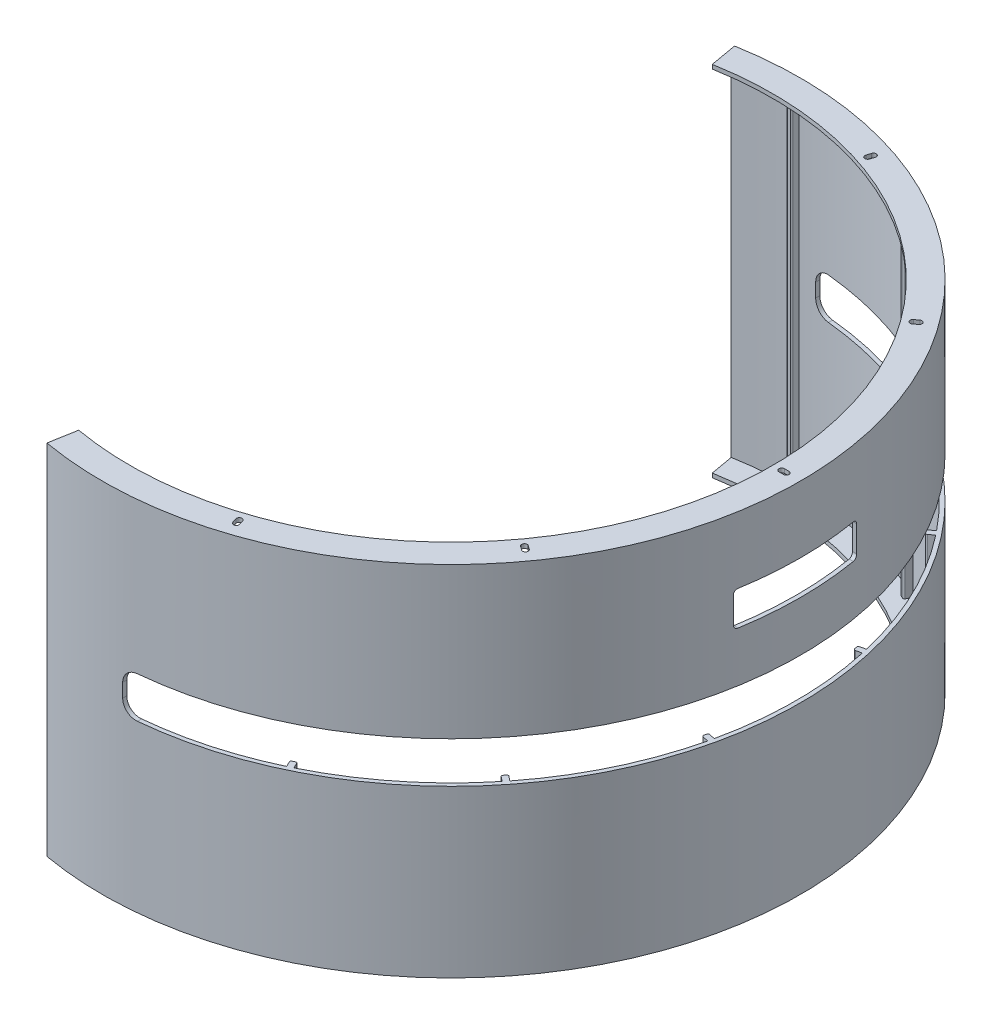
from build123d import *

# Parameters (mm, degrees)
BOSS_EXTRUDE1_DEPTH   = 255
BOSS_EXTRUDE2_DEPTH   = 255
BOSS_EXTRUDE2_2_DEPTH = 255
BOSS_EXTRUDE2_3_DEPTH = 255
BOSS_EXTRUDE2_4_DEPTH = 255
BOSS_EXTRUDE2_5_DEPTH = 255
BOSS_EXTRUDE2_6_DEPTH = 255
BOSS_EXTRUDE2_7_DEPTH = 255
BOSS_EXTRUDE2_8_DEPTH = 255
SKETCH4_W             = 480
SKETCH4_H             = 30
CUT_EXTRUDE2_DEPTH    = 476.5
FILLET2_R             = 10
BOSS_EXTRUDE3_DEPTH   = 3
CUT_EXTRUDE3_DEPTH    = 5
LPATTERN1_COUNT       = 2
LPATTERN1_PITCH       = 258
LPATTERN2_COUNT       = 2
LPATTERN2_PITCH       = 258
SKETCH9_W             = 27.100731328
SKETCH9_H             = 25
CUT_EXTRUDE4_DEPTH    = 45
FILLET3_R             = 3


with BuildPart() as part:
    # Sketch3 → Boss-Extrude1 (new body)
    with BuildSketch(Plane(origin=(0, 0, 0), x_dir=(1, 0, 0), z_dir=(0, 1, 0))):
        with BuildLine():
            ThreePointArc((0, 251.5), (251.5, 0), (0, -251.5))
            ThreePointArc((0, -251.5), (-21.919669301, -250.54296657), (-43.672516683, -247.679149883))
            Line((-43.672516683, -247.679149883), (-44.193461216, -250.633573142))
            ThreePointArc((-44.193461216, -250.633573142), (-22.181136529, -253.531550664), (0, -254.5))
            ThreePointArc((0, -254.5), (254.5, 0), (0, 254.5))
            ThreePointArc((0, 254.5), (-22.181136529, 253.531550664), (-44.193461216, 250.633573142))
            Line((-44.193461216, 250.633573142), (-43.672516683, 247.679149883))
            ThreePointArc((-43.672516683, 247.679149883), (-21.919669301, 250.54296657), (0, 251.5))
        make_face()
    extrude(amount=BOSS_EXTRUDE1_DEPTH)


with BuildPart() as body_2:
    # Sketch6 → Boss-Extrude2 (new body)
    with BuildSketch(Plane(origin=(0, 255, 0), x_dir=(1, 0, 0), z_dir=(0, 1, 0))):
        with BuildLine():
            Line((-2, 253.081926056), (-2, 247.081926056))
            ThreePointArc((-2, 247.081926056), (-1.707106781, 246.374819275), (-1, 246.081926056))
            Line((-1, 246.081926056), (1, 246.081926056))
            ThreePointArc((1, 246.081926056), (1.707106781, 246.374819275), (2, 247.081926056))
            Line((2, 247.081926056), (2, 253.081926056))
            Line((2, 253.081926056), (-2, 253.081926056))
        make_face()
    extrude(amount=-BOSS_EXTRUDE2_DEPTH)


with BuildPart() as body_3:
    # Sketch6 → Boss-Extrude2 2 (new body)
    with BuildSketch(Plane(origin=(0, 255, 0), x_dir=(1, 0, 0), z_dir=(0, 1, 0))):
        with BuildLine():
            Line((108.006194645, 228.886703884), (105.40289221, 223.480890676))
            ThreePointArc((105.40289221, 223.480890676), (105.359977747, 222.716727875), (105.869977339, 222.146038069))
            Line((105.869977339, 222.146038069), (107.671915074, 221.278270591))
            ThreePointArc((107.671915074, 221.278270591), (108.436077876, 221.235356129), (109.006767681, 221.74535572))
            Line((109.006767681, 221.74535572), (111.610070116, 227.151168927))
            Line((111.610070116, 227.151168927), (108.006194645, 228.886703884))
        make_face()
    extrude(amount=-BOSS_EXTRUDE2_2_DEPTH)


with BuildPart() as body_4:
    # Sketch6 → Boss-Extrude2 3 (new body)
    with BuildSketch(Plane(origin=(0, 255, 0), x_dir=(1, 0, 0), z_dir=(0, 1, 0))):
        with BuildLine():
            Line((196.620437831, 159.357662896), (191.929448936, 155.616724085))
            ThreePointArc((191.929448936, 155.616724085), (191.559226528, 154.946857078), (191.771107255, 154.2114028))
            Line((191.771107255, 154.2114028), (193.018086859, 152.647739835))
            ThreePointArc((193.018086859, 152.647739835), (193.687953865, 152.277517427), (194.423408143, 152.489398155))
            Line((194.423408143, 152.489398155), (199.114397038, 156.230336966))
            Line((199.114397038, 156.230336966), (196.620437831, 159.357662896))
        make_face()
    extrude(amount=-BOSS_EXTRUDE2_3_DEPTH)


with BuildPart() as body_5:
    # Sketch6 → Boss-Extrude2 4 (new body)
    with BuildSketch(Plane(origin=(0, 255, 0), x_dir=(1, 0, 0), z_dir=(0, 1, 0))):
        with BuildLine():
            Line((246.291591913, 58.265882378), (240.44202444, 56.930756774))
            ThreePointArc((240.44202444, 56.930756774), (239.817821175, 56.487860938), (239.689617462, 55.733307928))
            Line((239.689617462, 55.733307928), (240.13465933, 53.783452104))
            ThreePointArc((240.13465933, 53.783452104), (240.577555165, 53.159248838), (241.332108176, 53.031045125))
            Line((241.332108176, 53.031045125), (247.181675649, 54.366170729))
            Line((247.181675649, 54.366170729), (246.291591913, 58.265882378))
        make_face()
    extrude(amount=-BOSS_EXTRUDE2_4_DEPTH)


with BuildPart() as body_6:
    # Sketch6 → Boss-Extrude2 5 (new body)
    with BuildSketch(Plane(origin=(0, 255, 0), x_dir=(1, 0, 0), z_dir=(0, 1, 0))):
        with BuildLine():
            Line((247.181675649, -54.366170729), (241.332108176, -53.031045125))
            ThreePointArc((241.332108176, -53.031045125), (240.577555165, -53.159248838), (240.13465933, -53.783452104))
            Line((240.13465933, -53.783452104), (239.689617462, -55.733307928))
            ThreePointArc((239.689617462, -55.733307928), (239.817821175, -56.487860938), (240.44202444, -56.930756774))
            Line((240.44202444, -56.930756774), (246.291591913, -58.265882378))
            Line((246.291591913, -58.265882378), (247.181675649, -54.366170729))
        make_face()
    extrude(amount=-BOSS_EXTRUDE2_5_DEPTH)


with BuildPart() as body_7:
    # Sketch6 → Boss-Extrude2 6 (new body)
    with BuildSketch(Plane(origin=(0, 255, 0), x_dir=(1, 0, 0), z_dir=(0, 1, 0))):
        with BuildLine():
            Line((199.114397038, -156.230336966), (194.423408143, -152.489398155))
            ThreePointArc((194.423408143, -152.489398155), (193.687953865, -152.277517427), (193.018086859, -152.647739835))
            Line((193.018086859, -152.647739835), (191.771107255, -154.2114028))
            ThreePointArc((191.771107255, -154.2114028), (191.559226528, -154.946857078), (191.929448936, -155.616724085))
            Line((191.929448936, -155.616724085), (196.620437831, -159.357662896))
            Line((196.620437831, -159.357662896), (199.114397038, -156.230336966))
        make_face()
    extrude(amount=-BOSS_EXTRUDE2_6_DEPTH)


with BuildPart() as body_8:
    # Sketch6 → Boss-Extrude2 7 (new body)
    with BuildSketch(Plane(origin=(0, 255, 0), x_dir=(1, 0, 0), z_dir=(0, 1, 0))):
        with BuildLine():
            Line((111.610070116, -227.151168927), (109.006767681, -221.74535572))
            ThreePointArc((109.006767681, -221.74535572), (108.436077876, -221.235356129), (107.671915074, -221.278270591))
            Line((107.671915074, -221.278270591), (105.869977339, -222.146038069))
            ThreePointArc((105.869977339, -222.146038069), (105.359977747, -222.716727875), (105.40289221, -223.480890676))
            Line((105.40289221, -223.480890676), (108.006194645, -228.886703884))
            Line((108.006194645, -228.886703884), (111.610070116, -227.151168927))
        make_face()
    extrude(amount=-BOSS_EXTRUDE2_7_DEPTH)


with BuildPart() as body_9:
    # Sketch6 → Boss-Extrude2 8 (new body)
    with BuildSketch(Plane(origin=(0, 255, 0), x_dir=(1, 0, 0), z_dir=(0, 1, 0))):
        with BuildLine():
            Line((2, -253.081926056), (2, -247.081926056))
            ThreePointArc((2, -247.081926056), (1.707106781, -246.374819275), (1, -246.081926056))
            Line((1, -246.081926056), (-1, -246.081926056))
            ThreePointArc((-1, -246.081926056), (-1.707106781, -246.374819275), (-2, -247.081926056))
            Line((-2, -247.081926056), (-2, -253.081926056))
            Line((-2, -253.081926056), (2, -253.081926056))
        make_face()
    extrude(amount=-BOSS_EXTRUDE2_8_DEPTH)


with BuildPart() as body_2_1:
    add(body_2.part)

    # Combine2: union part, body 3, body 4, body 5, body 6, body 7, body 8, body 9
    add(part.part)
    add(body_3.part)
    add(body_4.part)
    add(body_5.part)
    add(body_6.part)
    add(body_7.part)
    add(body_8.part)
    add(body_9.part)

    # Sketch4 → Cut-Extrude2 (cut, symmetric)
    with BuildSketch(Plane.XY):
        with Locations((254.5, 133)):
            Rectangle(SKETCH4_W, SKETCH4_H)
    extrude(amount=CUT_EXTRUDE2_DEPTH, both=True, mode=Mode.SUBTRACT)

    # Fillet2
    fillet2_edges = [body_2_1.edges().sort_by_distance(p)[0] for p in [
        (14.5, 148, -252.584129717),
        (14.5, 118, -252.584129717),
        (14.5, 118, 252.584129717),
        (14.5, 148, 252.584129717),
    ]]
    fillet(fillet2_edges, radius=FILLET2_R)

    # Sketch7 → Boss-Extrude3 (add)
    with BuildSketch(Plane(origin=(0, 255, 0), x_dir=(1, 0, 0), z_dir=(0, 1, 0))):
        with BuildLine():
            ThreePointArc((-44.193461216, -250.633573142), (254.5, 0), (-44.193461216, 250.633573142))
            Line((-44.193461216, 250.633573142), (-40.720497663, 230.937418081))
            ThreePointArc((-40.720497663, 230.937418081), (234.5, 0), (-40.720497663, -230.937418081))
            Line((-40.720497663, -230.937418081), (-44.193461216, -250.633573142))
        make_face()
    boss_extrude3 = extrude(amount=BOSS_EXTRUDE3_DEPTH)

    # Sketch8 → Cut-Extrude3 (cut)
    with BuildSketch(Plane.XZ.offset(-255)):
        with BuildLine():
            Line((240.8, 2), (244.2, 2))
            ThreePointArc((244.2, 2), (246.2, 0), (244.2, -2))
            Line((244.2, -2), (240.8, -2))
            ThreePointArc((240.8, -2), (238.8, 0), (240.8, 2))
        make_face()
        with BuildLine():
            Line((195.98686275, -139.920654763), (198.737520531, -141.919124621))
            ThreePointArc((198.737520531, -141.919124621), (199.179984015, -144.712729114), (196.386379522, -145.155192599))
            Line((196.386379522, -145.155192599), (193.635721741, -143.156722741))
            ThreePointArc((193.635721741, -143.156722741), (193.193258257, -140.363118247), (195.98686275, -139.920654763))
        make_face()
        with BuildLine():
            Line((76.313405278, -228.396375135), (77.364063059, -231.629967291))
            ThreePointArc((77.364063059, -231.629967291), (76.079984015, -234.150114312), (73.559836994, -232.866035268))
            Line((73.559836994, -232.866035268), (72.509179213, -229.632443113))
            ThreePointArc((72.509179213, -229.632443113), (73.793258257, -227.112296091), (76.313405278, -228.396375135))
        make_face()
        with BuildLine():
            Line((-72.509179213, -229.632443113), (-73.559836994, -232.866035268))
            ThreePointArc((-73.559836994, -232.866035268), (-76.079984015, -234.150114312), (-77.364063059, -231.629967291))
            Line((-77.364063059, -231.629967291), (-76.313405278, -228.396375135))
            ThreePointArc((-76.313405278, -228.396375135), (-73.793258257, -227.112296091), (-72.509179213, -229.632443113))
        make_face()
        with BuildLine():
            Line((-193.635721741, -143.156722741), (-196.386379522, -145.155192599))
            ThreePointArc((-196.386379522, -145.155192599), (-199.179984015, -144.712729114), (-198.737520531, -141.919124621))
            Line((-198.737520531, -141.919124621), (-195.98686275, -139.920654763))
            ThreePointArc((-195.98686275, -139.920654763), (-193.193258257, -140.363118247), (-193.635721741, -143.156722741))
        make_face()
        with BuildLine():
            Line((-240.8, -2), (-244.2, -2))
            ThreePointArc((-244.2, -2), (-246.2, 0), (-244.2, 2))
            Line((-244.2, 2), (-240.8, 2))
            ThreePointArc((-240.8, 2), (-238.8, 0), (-240.8, -2))
        make_face()
        with BuildLine():
            Line((-195.98686275, 139.920654763), (-198.737520531, 141.919124621))
            ThreePointArc((-198.737520531, 141.919124621), (-199.179984015, 144.712729114), (-196.386379522, 145.155192599))
            Line((-196.386379522, 145.155192599), (-193.635721741, 143.156722741))
            ThreePointArc((-193.635721741, 143.156722741), (-193.193258257, 140.363118247), (-195.98686275, 139.920654763))
        make_face()
        with BuildLine():
            Line((-76.313405278, 228.396375135), (-77.364063059, 231.629967291))
            ThreePointArc((-77.364063059, 231.629967291), (-76.079984015, 234.150114312), (-73.559836994, 232.866035268))
            Line((-73.559836994, 232.866035268), (-72.509179213, 229.632443113))
            ThreePointArc((-72.509179213, 229.632443113), (-73.793258257, 227.112296091), (-76.313405278, 228.396375135))
        make_face()
        with BuildLine():
            Line((72.509179213, 229.632443113), (73.559836994, 232.866035268))
            ThreePointArc((73.559836994, 232.866035268), (76.079984015, 234.150114312), (77.364063059, 231.629967291))
            Line((77.364063059, 231.629967291), (76.313405278, 228.396375135))
            ThreePointArc((76.313405278, 228.396375135), (73.793258257, 227.112296091), (72.509179213, 229.632443113))
        make_face()
        with BuildLine():
            Line((193.635721741, 143.156722741), (196.386379522, 145.155192599))
            ThreePointArc((196.386379522, 145.155192599), (199.179984015, 144.712729114), (198.737520531, 141.919124621))
            Line((198.737520531, 141.919124621), (195.98686275, 139.920654763))
            ThreePointArc((195.98686275, 139.920654763), (193.193258257, 140.363118247), (193.635721741, 143.156722741))
        make_face()
    cut_extrude3 = extrude(amount=-CUT_EXTRUDE3_DEPTH, mode=Mode.SUBTRACT)

    # LPattern1: Boss-Extrude3 ×2
    with Locations(*[(0, -i * LPATTERN1_PITCH, 0) for i in range(1, LPATTERN1_COUNT)]):
        add(boss_extrude3)

    # LPattern2: Cut-Extrude3 ×2
    with Locations(*[(0, -i * LPATTERN2_PITCH, 0) for i in range(1, LPATTERN2_COUNT)]):
        add(cut_extrude3, mode=Mode.SUBTRACT)

    # Sketch9 → Cut-Extrude4 (cut, symmetric)
    with BuildSketch(Plane.XY):
        with Locations((254.5, 197)):
            Rectangle(SKETCH9_W, SKETCH9_H)
    extrude(amount=CUT_EXTRUDE4_DEPTH, both=True, mode=Mode.SUBTRACT)

    # Fillet3
    fillet3_edges = [body_2_1.edges().sort_by_distance(p)[0] for p in [
        (248.965713484, 209.5, 45),
        (248.965713484, 184.5, 45),
        (248.965713484, 184.5, -45),
        (248.965713484, 209.5, -45),
    ]]
    fillet(fillet3_edges, radius=FILLET3_R)


solid = body_2_1.part
